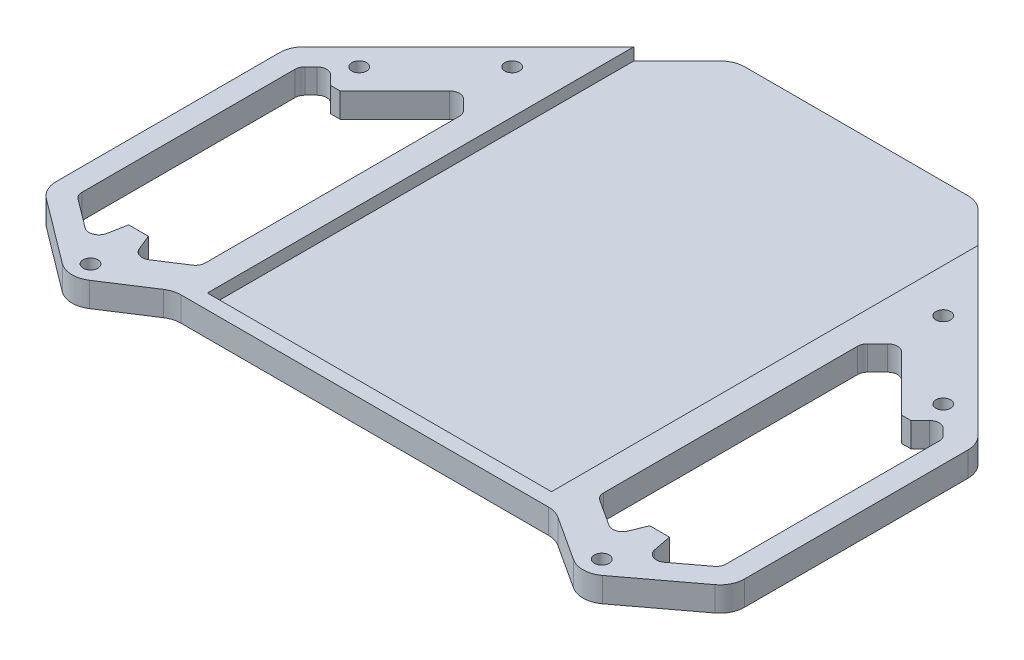
from build123d import *

# Parameters (mm, degrees)
SKETCH1_R            = 1.5
BOSS_EXTRUDE1_DEPTH  = 5
FILLET1_R            = 2
FILLET1_OF_MIRROR1_R = 2
SKETCH2_W            = 70
SKETCH2_H            = 97
CUT_EXTRUDE1_DEPTH   = 2.5
FILLET2_R            = 5


with BuildPart() as part:
    # Sketch1 → Boss-Extrude1 (new body)
    with BuildSketch(Plane(origin=(0, 0, 0), x_dir=(1, 0, 0), z_dir=(0, 1, 0))):
        Polygon((-52.164149312, -38.645247828), (-70, -25.247940817), (-70, 24.752308679), (-24.752308679, 70), (0, 70), (0, -30), (-38.851635079, -30), align=None)
        with Locations((-43.840620434, 43.840620434)):
            Circle(SKETCH1_R, mode=Mode.SUBTRACT)
        with Locations((-51.997575213, -33.767620171)):
            Circle(SKETCH1_R, mode=Mode.SUBTRACT)
        with Locations((-59.39696962, 28.284271247)):
            Circle(SKETCH1_R, mode=Mode.SUBTRACT)
        Polygon((-59.003765723, 22.1), (-57.095959493, 22.1), (-44.547727215, 34.648232278), (-40.5, 30.600505063), (-40.5, -23), (-48.796166422, -28.387593469), (-51, -23), (-55, -23), (-56.33662338, -29.883022962), (-65.5, -23), (-65.5, 22.181240867), (-62.292503295, 25.388737572), align=None, mode=Mode.SUBTRACT)
    boss_extrude1 = extrude(amount=BOSS_EXTRUDE1_DEPTH)

    # Fillet1
    fillet1_edges = [part.edges().sort_by_distance(p)[0] for p in [
        (-40.5, 2.5, 23),
        (-48.796166422, 2.5, 28.387593469),
        (-56.33662338, 2.5, 29.883022962),
        (-65.5, 2.5, 23),
        (-65.5, 2.5, -22.181240867),
        (-62.292503295, 2.5, -25.388737572),
        (-40.5, 2.5, -30.600505063),
        (-44.547727215, 2.5, -34.648232278),
    ]]
    fillet(fillet1_edges, radius=FILLET1_R)

    # Mirror1: Boss-Extrude1 across plane
    add(boss_extrude1.mirror(Plane(origin=(0, 5, 30), x_dir=(0, 0, 1), z_dir=(-1, 0, 0))))

    # Fillet1 of Mirror1
    fillet1_of_mirror1_edges = [part.edges().sort_by_distance(p)[0] for p in [
        (40.5, 2.5, 23),
        (48.796166422, 2.5, 28.387593469),
        (56.33662338, 2.5, 29.883022962),
        (65.5, 2.5, 23),
        (65.5, 2.5, -22.181240867),
        (62.292503295, 2.5, -25.388737572),
        (40.5, 2.5, -30.600505063),
        (44.547727215, 2.5, -34.648232278),
    ]]
    fillet(fillet1_of_mirror1_edges, radius=FILLET1_OF_MIRROR1_R)

    # Sketch2 → Cut-Extrude1 (cut)
    with BuildSketch(Plane(origin=(0, 5, 0), x_dir=(1, 0, 0), z_dir=(0, 1, 0))):
        with Locations((0, 21.5)):
            Rectangle(SKETCH2_W, SKETCH2_H)
    extrude(amount=-CUT_EXTRUDE1_DEPTH, mode=Mode.SUBTRACT)

    # Fillet2
    fillet2_edges = [part.edges().sort_by_distance(p)[0] for p in [
        (70, 2.5, -24.752308679),
        (24.752308679, 1.25, -70),
        (-24.752308679, 1.25, -70),
        (-70, 2.5, -24.752308679),
        (-70, 2.5, 25.247940817),
        (70, 2.5, 25.247940817),
        (52.164149312, 2.5, 38.645247828),
        (38.851635079, 2.5, 30),
        (-38.851635079, 2.5, 30),
        (-52.164149312, 2.5, 38.645247828),
    ]]
    fillet(fillet2_edges, radius=FILLET2_R)


solid = part.part
